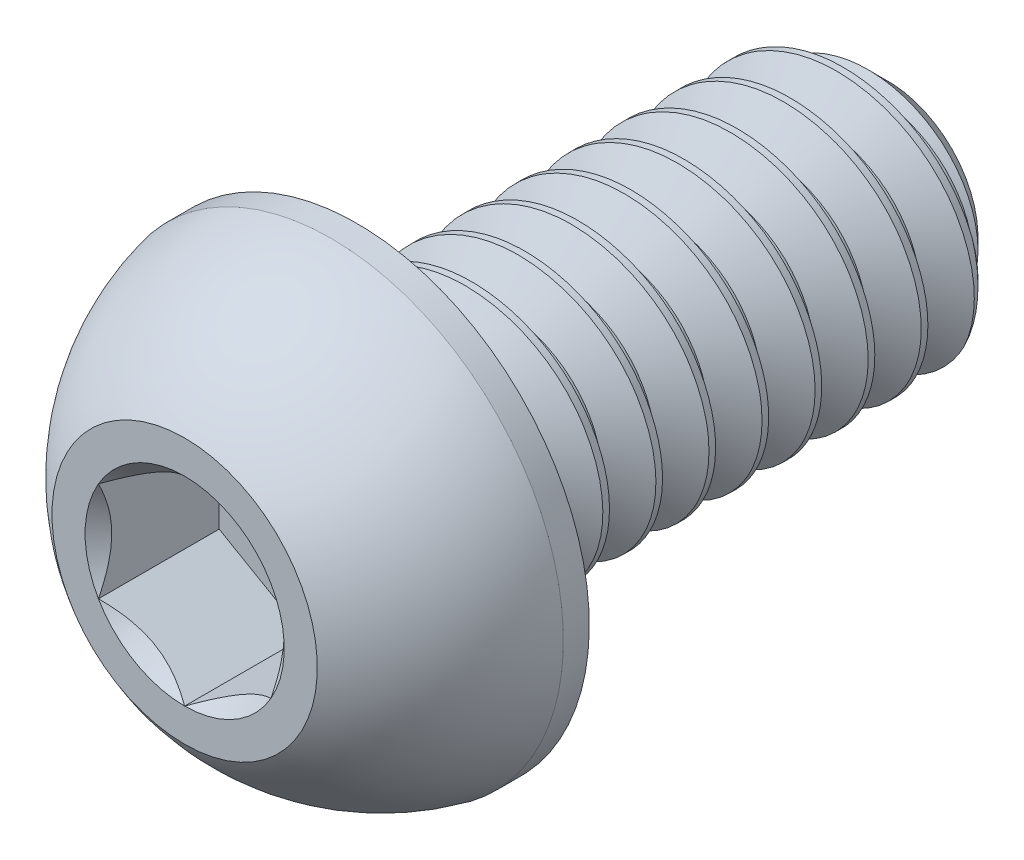
from build123d import *

# Parameters (mm, degrees)
CUT_EXTRUDE1_DEPTH = 0.91
CUT_SWEEP1_PITCH   = 0.4


# Read off the part's stored shape, not the designer's step: Split1, Boss-Extrude1
with BuildPart() as part:
    # Sketch2 → Revolve1 (revolve)
    with BuildSketch(Plane(origin=(0, 0, 0), x_dir=(0, 0, -1), z_dir=(1, 0, 0)), mode=Mode.PRIVATE) as revolve1_sk:
        with BuildLine():
            Line((-2.65, 0), (2.65, 0))
            Line((2.65, 0), (2.65, 0.68))
            Line((2.65, 0.68), (2.33, 1))
            Line((2.33, 1), (-1.35, 1))
            Line((-1.35, 1), (-1.35, 1.75))
            Line((-1.35, 1.75), (-1.545, 1.75))
            ThreePointArc((-1.545, 1.75), (-2.170023043, 1.481850617), (-2.65, 1))
            Line((-2.65, 1), (-2.65, 0))
        make_face()
    revolve(revolve1_sk.sketch.rotate(Axis((0, 0, 2.65), (0, 0, -1)), 180), axis=Axis((0, 0, 2.65), (0, 0, -1)))

    # Sketch3 → Cut-Extrude1 (cut)
    with BuildSketch(Plane.XY.offset(2.65)):
        Polygon((0, 0.75055535), (-0.65, 0.375277675), (-0.65, -0.375277675), (0, -0.75055535), (0.65, -0.375277675), (0.65, 0.375277675), align=None)
    extrude(amount=-CUT_EXTRUDE1_DEPTH, mode=Mode.SUBTRACT)

    # Cut-Extrude2 cone 1 section (through the dimple's axis) → Cut-Extrude2 (revolve, cut)
    with BuildSketch(Plane(origin=(0, 0, 2.65), x_dir=(0, -1, 0), z_dir=(1, 0, 0))):
        Polygon((0, 0), (0.75055535, 0), (0, 0.75055535), align=None)
    revolve(axis=Axis((0, 0, 2.65), (0, 0, -1)), mode=Mode.SUBTRACT)


with BuildPart() as body_2:
    # Split1: the piece on the far side of the plane
    add(part.part)
    split(bisect_by=Plane.XY.offset(1.35), keep=Keep.BOTTOM)

    # Cut-Sweep1: the profile of Sketch6 screwed along a right-hand helix of 11 turns, 6 arcs to a turn; built about Z, then put on its axis
    cut_sweep1_z = Axis((0, 0, 0), (0, 0, 1))
    cut_sweep1_corners = [(0.740192379, 0, -0.15), (0.740192379, 0, -0.2), (1.021650635, 0, -0.3625), (1.021650635, 0, 0.0125)]
    with BuildLine(mode=Mode.PRIVATE) as cut_sweep1_profile:
        Line(cut_sweep1_corners[0], cut_sweep1_corners[1])
        Line(cut_sweep1_corners[1], cut_sweep1_corners[2])
        Line(cut_sweep1_corners[2], cut_sweep1_corners[3])
        Line(cut_sweep1_corners[3], cut_sweep1_corners[0])
    cut_sweep1_cap = Face(cut_sweep1_profile.wire())
    cut_sweep1_turn_angles = [0, 30, 60, 90, 120, 150, 180, 210, 240, 270, 300, 330, 360]
    cut_sweep1_turn_weights = [1, 0.8660254037844387, 1, 0.8660254037844387, 1, 0.8660254037844387, 1, 0.8660254037844387, 1, 0.8660254037844387, 1, 0.8660254037844387, 1]
    cut_sweep1_turn_rails = [Edge.make_bspline([Vector(p[0], p[1], 0).rotate(cut_sweep1_z, cut_sweep1_turn_angles[k]) / cut_sweep1_turn_weights[k] + Vector(0, 0, p[2] + CUT_SWEEP1_PITCH * cut_sweep1_turn_angles[k] / 360) for k in range(13)], [0, 0, 0, 1, 1, 2, 2, 3, 3, 4, 4, 5, 5, 6, 6, 6], 2, cut_sweep1_turn_weights) for p in cut_sweep1_corners]
    cut_sweep1_turn_sides = [Face.make_surface_from_curves(cut_sweep1_turn_rails[p[0]], cut_sweep1_turn_rails[p[1]]) for p in [(0, 1), (1, 2), (2, 3), (3, 0)]]
    cut_sweep1 = Plane(origin=(0, 0, -2.65), x_dir=(0, 1, 0), z_dir=(0, 0, 1)) * Solid(Shell([*[p.moved(Location((0, 0, CUT_SWEEP1_PITCH * i))) for i in range(11) for p in cut_sweep1_turn_sides], cut_sweep1_cap, cut_sweep1_cap.rotate(cut_sweep1_z, 3960).moved(Location((0, 0, CUT_SWEEP1_PITCH * 3960 / 360)))]))
    add(cut_sweep1, mode=Mode.SUBTRACT)


with BuildPart() as part_1:
    add(part.part)

    # Split1
    split(bisect_by=Plane.XY.offset(1.35), keep=Keep.TOP)

    add(body_2.part)  # Boss-Extrude1 merges body 2
    # Boss-Extrude1 outline → Boss-Extrude1 (revolve)
    with BuildSketch(Plane.XZ):
        Polygon((0.740190996, 1.35), (0.740190996, 0.899997606), (1, 1.35), align=None)
    revolve(axis=Axis((0, 0, 0), (0, 0, 1)))


solid = part_1.part
